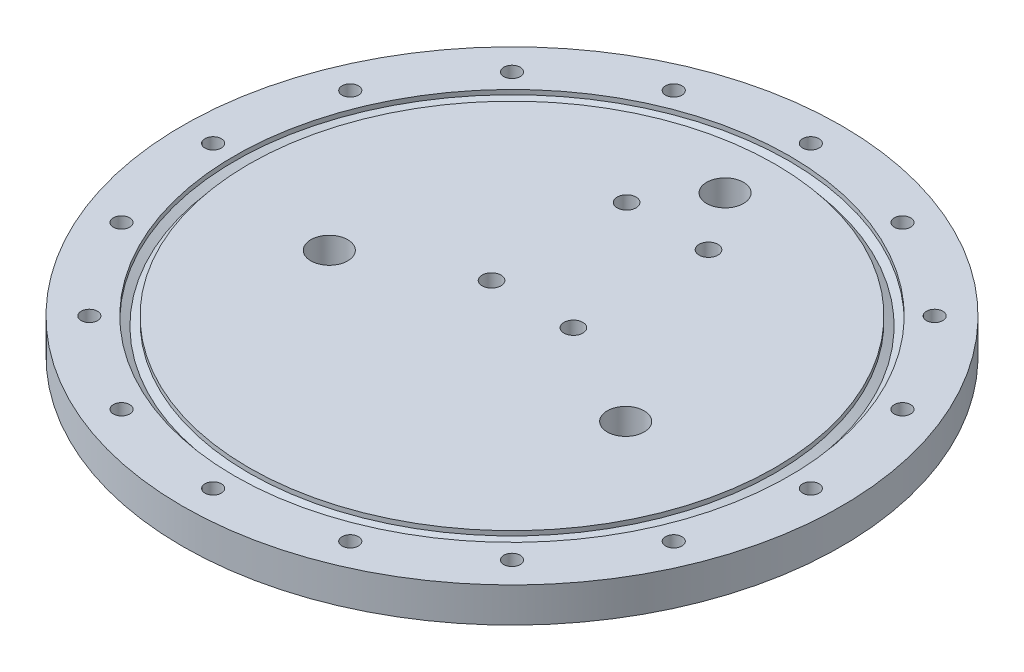
from build123d import *

# Parameters (mm, degrees)
SKETCH1_R           = 80.5
BOSS_EXTRUDE1_DEPTH = 8.5
CUT_EXTRUDE1_REACH  = 116.161
SKETCH2_R           = 2
CUT_EXTRUDE2_REACH  = 116.161
SKETCH5_R           = 4.5
SKETCH6_R           = 2.3
CUT_EXTRUDE3_DEPTH  = 5


with BuildPart() as part:
    # Sketch1 → Boss-Extrude1 (new body)
    with BuildSketch(Plane(origin=(0, 0, 0), x_dir=(1, 0, 0), z_dir=(0, 1, 0))):
        Circle(SKETCH1_R)
    extrude(amount=BOSS_EXTRUDE1_DEPTH)

    # Sketch2 → Cut-Extrude1 (cut, up to next)
    with BuildSketch(Plane(origin=(0, 8.5, 0), x_dir=(1, 0, 0), z_dir=(0, 1, 0)), mode=Mode.PRIVATE) as cut_extrude1_sk1:
        with Locations((0, 73)):
            Circle(SKETCH2_R)
    cut_extrude1_tool1 = extrude(cut_extrude1_sk1.sketch, amount=-CUT_EXTRUDE1_REACH, mode=Mode.PRIVATE) & part.part
    # Sketch2 → Cut-Extrude1 (cut, up to next)
    with BuildSketch(Plane(origin=(0, 8.5, 0), x_dir=(1, 0, 0), z_dir=(0, 1, 0)), mode=Mode.PRIVATE) as cut_extrude1_sk2:
        with Locations((27.935890563, 67.443205873)):
            Circle(SKETCH2_R)
    cut_extrude1_tool2 = extrude(cut_extrude1_sk2.sketch, amount=-CUT_EXTRUDE1_REACH, mode=Mode.PRIVATE) & part.part
    # Sketch2 → Cut-Extrude1 (cut, up to next)
    with BuildSketch(Plane(origin=(0, 8.5, 0), x_dir=(1, 0, 0), z_dir=(0, 1, 0)), mode=Mode.PRIVATE) as cut_extrude1_sk3:
        with Locations((51.618795027, 51.618795027)):
            Circle(SKETCH2_R)
    cut_extrude1_tool3 = extrude(cut_extrude1_sk3.sketch, amount=-CUT_EXTRUDE1_REACH, mode=Mode.PRIVATE) & part.part
    # Sketch2 → Cut-Extrude1 (cut, up to next)
    with BuildSketch(Plane(origin=(0, 8.5, 0), x_dir=(1, 0, 0), z_dir=(0, 1, 0)), mode=Mode.PRIVATE) as cut_extrude1_sk4:
        with Locations((67.443205873, 27.935890563)):
            Circle(SKETCH2_R)
    cut_extrude1_tool4 = extrude(cut_extrude1_sk4.sketch, amount=-CUT_EXTRUDE1_REACH, mode=Mode.PRIVATE) & part.part
    # Sketch2 → Cut-Extrude1 (cut, up to next)
    with BuildSketch(Plane(origin=(0, 8.5, 0), x_dir=(1, 0, 0), z_dir=(0, 1, 0)), mode=Mode.PRIVATE) as cut_extrude1_sk5:
        with Locations((73, 0)):
            Circle(SKETCH2_R)
    cut_extrude1_tool5 = extrude(cut_extrude1_sk5.sketch, amount=-CUT_EXTRUDE1_REACH, mode=Mode.PRIVATE) & part.part
    # Sketch2 → Cut-Extrude1 (cut, up to next)
    with BuildSketch(Plane(origin=(0, 8.5, 0), x_dir=(1, 0, 0), z_dir=(0, 1, 0)), mode=Mode.PRIVATE) as cut_extrude1_sk6:
        with Locations((67.443205873, -27.935890563)):
            Circle(SKETCH2_R)
    cut_extrude1_tool6 = extrude(cut_extrude1_sk6.sketch, amount=-CUT_EXTRUDE1_REACH, mode=Mode.PRIVATE) & part.part
    # Sketch2 → Cut-Extrude1 (cut, up to next)
    with BuildSketch(Plane(origin=(0, 8.5, 0), x_dir=(1, 0, 0), z_dir=(0, 1, 0)), mode=Mode.PRIVATE) as cut_extrude1_sk7:
        with Locations((51.618795027, -51.618795027)):
            Circle(SKETCH2_R)
    cut_extrude1_tool7 = extrude(cut_extrude1_sk7.sketch, amount=-CUT_EXTRUDE1_REACH, mode=Mode.PRIVATE) & part.part
    # Sketch2 → Cut-Extrude1 (cut, up to next)
    with BuildSketch(Plane(origin=(0, 8.5, 0), x_dir=(1, 0, 0), z_dir=(0, 1, 0)), mode=Mode.PRIVATE) as cut_extrude1_sk8:
        with Locations((27.935890563, -67.443205873)):
            Circle(SKETCH2_R)
    cut_extrude1_tool8 = extrude(cut_extrude1_sk8.sketch, amount=-CUT_EXTRUDE1_REACH, mode=Mode.PRIVATE) & part.part
    # Sketch2 → Cut-Extrude1 (cut, up to next)
    with BuildSketch(Plane(origin=(0, 8.5, 0), x_dir=(1, 0, 0), z_dir=(0, 1, 0)), mode=Mode.PRIVATE) as cut_extrude1_sk9:
        with Locations((0, -73)):
            Circle(SKETCH2_R)
    cut_extrude1_tool9 = extrude(cut_extrude1_sk9.sketch, amount=-CUT_EXTRUDE1_REACH, mode=Mode.PRIVATE) & part.part
    # Sketch2 → Cut-Extrude1 (cut, up to next)
    with BuildSketch(Plane(origin=(0, 8.5, 0), x_dir=(1, 0, 0), z_dir=(0, 1, 0)), mode=Mode.PRIVATE) as cut_extrude1_sk10:
        with Locations((-27.935890563, -67.443205873)):
            Circle(SKETCH2_R)
    cut_extrude1_tool10 = extrude(cut_extrude1_sk10.sketch, amount=-CUT_EXTRUDE1_REACH, mode=Mode.PRIVATE) & part.part
    # Sketch2 → Cut-Extrude1 (cut, up to next)
    with BuildSketch(Plane(origin=(0, 8.5, 0), x_dir=(1, 0, 0), z_dir=(0, 1, 0)), mode=Mode.PRIVATE) as cut_extrude1_sk11:
        with Locations((-51.618795027, -51.618795027)):
            Circle(SKETCH2_R)
    cut_extrude1_tool11 = extrude(cut_extrude1_sk11.sketch, amount=-CUT_EXTRUDE1_REACH, mode=Mode.PRIVATE) & part.part
    # Sketch2 → Cut-Extrude1 (cut, up to next)
    with BuildSketch(Plane(origin=(0, 8.5, 0), x_dir=(1, 0, 0), z_dir=(0, 1, 0)), mode=Mode.PRIVATE) as cut_extrude1_sk12:
        with Locations((-67.443205873, -27.935890563)):
            Circle(SKETCH2_R)
    cut_extrude1_tool12 = extrude(cut_extrude1_sk12.sketch, amount=-CUT_EXTRUDE1_REACH, mode=Mode.PRIVATE) & part.part
    # Sketch2 → Cut-Extrude1 (cut, up to next)
    with BuildSketch(Plane(origin=(0, 8.5, 0), x_dir=(1, 0, 0), z_dir=(0, 1, 0)), mode=Mode.PRIVATE) as cut_extrude1_sk13:
        with Locations((-73, 0)):
            Circle(SKETCH2_R)
    cut_extrude1_tool13 = extrude(cut_extrude1_sk13.sketch, amount=-CUT_EXTRUDE1_REACH, mode=Mode.PRIVATE) & part.part
    # Sketch2 → Cut-Extrude1 (cut, up to next)
    with BuildSketch(Plane(origin=(0, 8.5, 0), x_dir=(1, 0, 0), z_dir=(0, 1, 0)), mode=Mode.PRIVATE) as cut_extrude1_sk14:
        with Locations((-67.443205873, 27.935890563)):
            Circle(SKETCH2_R)
    cut_extrude1_tool14 = extrude(cut_extrude1_sk14.sketch, amount=-CUT_EXTRUDE1_REACH, mode=Mode.PRIVATE) & part.part
    # Sketch2 → Cut-Extrude1 (cut, up to next)
    with BuildSketch(Plane(origin=(0, 8.5, 0), x_dir=(1, 0, 0), z_dir=(0, 1, 0)), mode=Mode.PRIVATE) as cut_extrude1_sk15:
        with Locations((-51.618795027, 51.618795027)):
            Circle(SKETCH2_R)
    cut_extrude1_tool15 = extrude(cut_extrude1_sk15.sketch, amount=-CUT_EXTRUDE1_REACH, mode=Mode.PRIVATE) & part.part
    # Sketch2 → Cut-Extrude1 (cut, up to next)
    with BuildSketch(Plane(origin=(0, 8.5, 0), x_dir=(1, 0, 0), z_dir=(0, 1, 0)), mode=Mode.PRIVATE) as cut_extrude1_sk16:
        with Locations((-27.935890563, 67.443205873)):
            Circle(SKETCH2_R)
    cut_extrude1_tool16 = extrude(cut_extrude1_sk16.sketch, amount=-CUT_EXTRUDE1_REACH, mode=Mode.PRIVATE) & part.part
    add(cut_extrude1_tool1.solids().sort_by_distance((0, 8.5, -73))[0], mode=Mode.SUBTRACT)
    add(cut_extrude1_tool2.solids().sort_by_distance((27.935891, 8.5, -67.443206))[0], mode=Mode.SUBTRACT)
    add(cut_extrude1_tool3.solids().sort_by_distance((51.618795, 8.5, -51.618795))[0], mode=Mode.SUBTRACT)
    add(cut_extrude1_tool4.solids().sort_by_distance((67.443206, 8.5, -27.935891))[0], mode=Mode.SUBTRACT)
    add(cut_extrude1_tool5.solids().sort_by_distance((73, 8.5, 0))[0], mode=Mode.SUBTRACT)
    add(cut_extrude1_tool6.solids().sort_by_distance((67.443206, 8.5, 27.935891))[0], mode=Mode.SUBTRACT)
    add(cut_extrude1_tool7.solids().sort_by_distance((51.618795, 8.5, 51.618795))[0], mode=Mode.SUBTRACT)
    add(cut_extrude1_tool8.solids().sort_by_distance((27.935891, 8.5, 67.443206))[0], mode=Mode.SUBTRACT)
    add(cut_extrude1_tool9.solids().sort_by_distance((0, 8.5, 73))[0], mode=Mode.SUBTRACT)
    add(cut_extrude1_tool10.solids().sort_by_distance((-27.935891, 8.5, 67.443206))[0], mode=Mode.SUBTRACT)
    add(cut_extrude1_tool11.solids().sort_by_distance((-51.618795, 8.5, 51.618795))[0], mode=Mode.SUBTRACT)
    add(cut_extrude1_tool12.solids().sort_by_distance((-67.443206, 8.5, 27.935891))[0], mode=Mode.SUBTRACT)
    add(cut_extrude1_tool13.solids().sort_by_distance((-73, 8.5, 0))[0], mode=Mode.SUBTRACT)
    add(cut_extrude1_tool14.solids().sort_by_distance((-67.443206, 8.5, -27.935891))[0], mode=Mode.SUBTRACT)
    add(cut_extrude1_tool15.solids().sort_by_distance((-51.618795, 8.5, -51.618795))[0], mode=Mode.SUBTRACT)
    add(cut_extrude1_tool16.solids().sort_by_distance((-27.935891, 8.5, -67.443206))[0], mode=Mode.SUBTRACT)

    # Sketch5 → Cut-Extrude2 (cut, up to next)
    with BuildSketch(Plane.XZ, mode=Mode.PRIVATE) as cut_extrude2_sk1:
        with Locations((36.2, 8.43)):
            Circle(SKETCH5_R)
    cut_extrude2_tool1 = extrude(cut_extrude2_sk1.sketch, amount=-CUT_EXTRUDE2_REACH, mode=Mode.PRIVATE) & part.part
    # Sketch5 → Cut-Extrude2 (cut, up to next)
    with BuildSketch(Plane.XZ, mode=Mode.PRIVATE) as cut_extrude2_sk2:
        with Locations((-36.2, 8.43)):
            Circle(SKETCH5_R)
    cut_extrude2_tool2 = extrude(cut_extrude2_sk2.sketch, amount=-CUT_EXTRUDE2_REACH, mode=Mode.PRIVATE) & part.part
    # Sketch5 → Cut-Extrude2 (cut, up to next)
    with BuildSketch(Plane.XZ, mode=Mode.PRIVATE) as cut_extrude2_sk3:
        with Locations((0, -52.046294895)):
            Circle(SKETCH5_R)
    cut_extrude2_tool3 = extrude(cut_extrude2_sk3.sketch, amount=-CUT_EXTRUDE2_REACH, mode=Mode.PRIVATE) & part.part
    add(cut_extrude2_tool1.solids().sort_by_distance((36.2, 0, 8.43))[0], mode=Mode.SUBTRACT)
    add(cut_extrude2_tool2.solids().sort_by_distance((-36.2, 0, 8.43))[0], mode=Mode.SUBTRACT)
    add(cut_extrude2_tool3.solids().sort_by_distance((0, 0, -52.046295))[0], mode=Mode.SUBTRACT)

    # Sketch4 → Cut-Revolve1 (revolve, cut)
    with BuildSketch(Plane.XY):
        Polygon((67.75, 7.380362971), (67.75, 8.5), (64.25, 8.5), (64.25, 7.380362971), (66, 6.37), align=None)
    revolve(axis=Axis((0, 0, 0), (0, 1, 0)), mode=Mode.SUBTRACT)

    # Sketch6 → Cut-Extrude3 (cut)
    with BuildSketch(Plane(origin=(0, 8.5, 0), x_dir=(1, 0, 0), z_dir=(0, 1, 0))):
        with Locations((-10, 5)):
            Circle(SKETCH6_R)
        with Locations((10, 5)):
            Circle(SKETCH6_R)
        with Locations((-10, 38)):
            Circle(SKETCH6_R)
        with Locations((10, 38)):
            Circle(SKETCH6_R)
    extrude(amount=-CUT_EXTRUDE3_DEPTH, mode=Mode.SUBTRACT)


solid = part.part
